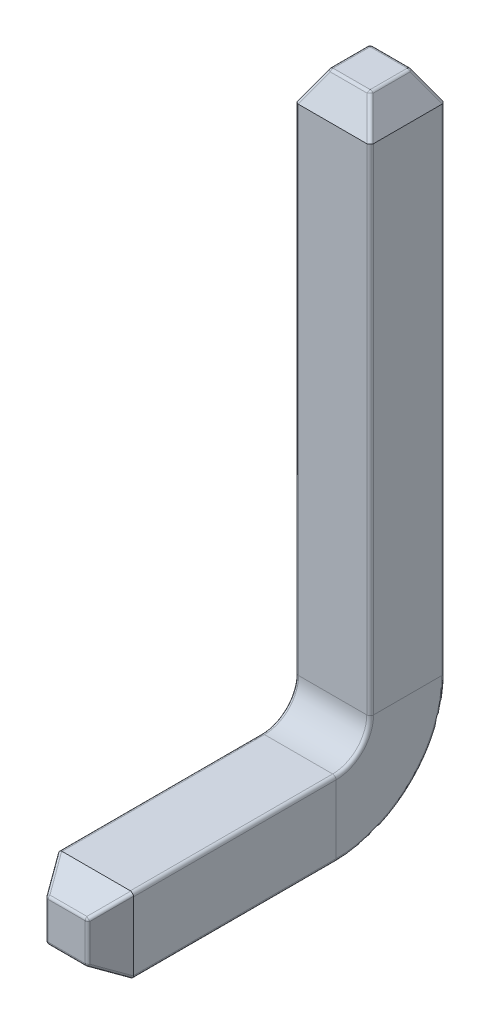
from build123d import *

# Parameters (mm, degrees)
SKETCH2_W                        = 0.44
SKETCH2_H                        = 3.715
BASE_FLANGE1_DEPTH               = 0.44
SM_EDGE_FLANGE_1_STRIP_W         = 2.16
SM_EDGE_FLANGE_1_STRIP_H         = 0.44
SM_EDGE_FLANGE_1_STRIP_CUT_DEPTH = 0.44
SM_EDGE_FLANGE_1_DEPTH           = 0.44
CHAMFER2_SIZE                    = 0.1
CHAMFER2_SIZE2                   = 0.173205081
CHAMFER3_SIZE                    = 0.1
CHAMFER3_SIZE2                   = 0.173205081
FILLET1_R                        = 0.02


# Sheet-metal steps are written as plain solids
with BuildPart() as part:
    # Base-Flange1: sheet metal written as solids
    # Sketch2 → Base-Flange1 (new body)
    with BuildSketch(Plane.XY):
        Rectangle(SKETCH2_W, SKETCH2_H)
    extrude(amount=-BASE_FLANGE1_DEPTH)

    # 边线-法兰1: sheet metal written as solids
    # 边线-法兰1 strip (on a plane across the edge) → 边线-法兰1 strip cut (cut)
    with BuildSketch(Plane(origin=(-0.22, -1.8575, 0), x_dir=(0, 1, 0), z_dir=(1, 0, 0))):
        with Locations((-0.44, -0.22)):
            Rectangle(SM_EDGE_FLANGE_1_STRIP_W, SM_EDGE_FLANGE_1_STRIP_H)
    extrude(amount=SM_EDGE_FLANGE_1_STRIP_CUT_DEPTH, mode=Mode.SUBTRACT)

    # 边线-法兰1 section (on a plane across the edge) → 边线-法兰1 (add)
    with BuildSketch(Plane(origin=(-0.22, -1.8575, 0), x_dir=(0, 1, 0), z_dir=(1, 0, 0))):
        with BuildLine():
            Line((0, 0.2), (0, 1.56))
            Line((0, 1.56), (0.44, 1.56))
            Line((0.44, 1.56), (0.44, 0.2))
            ThreePointArc((0.44, 0.2), (0.498578644, 0.058578644), (0.64, 0))
            Line((0.64, 0), (0.64, -0.44))
            ThreePointArc((0.64, -0.44), (0.18745166, -0.25254834), (0, 0.2))
        make_face()
    extrude(amount=SM_EDGE_FLANGE_1_DEPTH)

    # Chamfer2
    chamfer2_edges = [part.edges().sort_by_distance(p)[0] for p in [
        (0, 1.8575, 0),
        (-0.22, 1.8575, -0.22),
        (0.22, 1.8575, -0.22),
        (0, 1.8575, -0.44),
    ]]
    chamfer2_side = [part.faces().sort_by_distance(p)[0] for p in [
        (0, 1.8575, -0.22),
    ]]
    chamfer(chamfer2_edges, length=CHAMFER2_SIZE, length2=CHAMFER2_SIZE2, reference=chamfer2_side[0])

    # Chamfer3
    chamfer3_edges = [part.edges().sort_by_distance(p)[0] for p in [
        (-0.22, -1.6375, 1.56),
        (0, -1.8575, 1.56),
        (0, -1.4175, 1.56),
        (0.22, -1.6375, 1.56),
    ]]
    chamfer3_side = [part.faces().sort_by_distance(p)[0] for p in [
        (0, -1.6375, 1.56),
    ]]
    chamfer(chamfer3_edges, length=CHAMFER3_SIZE, length2=CHAMFER3_SIZE2, reference=chamfer3_side[0])

    # Fillet1
    # the kernel refuses this fillet: 0.02 mm, written as the material it takes off along each edge
    with BuildSketch(Plane(origin=(-0.108452995, 1.8375, -0.111547005), x_dir=(0.8320502943378433, 0.48038446141526264, -0.27735009811261363), z_dir=(-0.36927447293799925, 0.8528028654224409, 0.3692744729379992))) as fillet1_piece_1_section:
        Polygon((-0.030983867, -0.030983867), (0.030983867, -0.030983867), (0.030983867, 0.030983867), (-0.030983867, 0.030983867), align=None)
    fillet1_piece_1 = extrude(amount=0.030983867, mode=Mode.PRIVATE)
    fillet1_piece_1 = split(fillet1_piece_1, bisect_by=Plane(origin=(-0.108452995, 1.8375, -0.111547005), z_dir=(-1, 0, 0)), keep=Keep.TOP, mode=Mode.PRIVATE)
    fillet1_piece_1 = split(fillet1_piece_1, bisect_by=Plane(origin=(-0.108452995, 1.8375, -0.111547005), z_dir=(0, 0, 1)), keep=Keep.TOP, mode=Mode.PRIVATE)
    fillet1_piece_1 = split(fillet1_piece_1, bisect_by=Plane(origin=(-0.108452995, 1.8375, -0.111547005), z_dir=(0.4472135954999562, 0.7745966692414853, -0.4472135954999563)), keep=Keep.TOP, mode=Mode.PRIVATE)
    fillet1_piece_1 = split(fillet1_piece_1, bisect_by=Plane(origin=(-0.108452995, 1.8475, -0.094226497), z_dir=(0, -0.4999999999999977, -0.8660254037844399)), keep=Keep.TOP, mode=Mode.PRIVATE)
    fillet1_piece_1 = split(fillet1_piece_1, bisect_by=Plane(origin=(-0.108452995, 1.8575, -0.111547005), z_dir=(0, -1, 0)), keep=Keep.TOP, mode=Mode.PRIVATE)
    fillet1_piece_1 = split(fillet1_piece_1, bisect_by=Plane(origin=(-0.125773503, 1.8475, -0.111547005), z_dir=(0.86602540378444, -0.4999999999999976, 0)), keep=Keep.TOP, mode=Mode.PRIVATE)
    fillet1_piece_1 = fillet1_piece_1 - Plane(origin=(-0.108452995, 1.8375, -0.111547005), x_dir=(0.36927447293799925, -0.8528028654224409, -0.3692744729379992), z_dir=(0.8320502943378433, 0.48038446141526264, -0.27735009811261363)) * Sphere(FILLET1_R, mode=Mode.PRIVATE)
    add(fillet1_piece_1, mode=Mode.SUBTRACT)
    with BuildSketch(Plane(origin=(0.108452995, 1.8375, -0.111547005), x_dir=(-0.27735009811261363, 0.48038446141526264, -0.8320502943378434), z_dir=(0.36927447293799914, 0.8528028654224408, 0.36927447293799914))) as fillet1_piece_2_section:
        Polygon((-0.030983867, -0.030983867), (0.030983867, -0.030983867), (0.030983867, 0.030983867), (-0.030983867, 0.030983867), align=None)
    fillet1_piece_2 = extrude(amount=0.030983867, mode=Mode.PRIVATE)
    fillet1_piece_2 = split(fillet1_piece_2, bisect_by=Plane(origin=(0.108452995, 1.8375, -0.111547005), z_dir=(-0.4472135954999564, 0.7745966692414853, -0.4472135954999563)), keep=Keep.TOP, mode=Mode.PRIVATE)
    fillet1_piece_2 = split(fillet1_piece_2, bisect_by=Plane(origin=(0.108452995, 1.8375, -0.111547005), z_dir=(1, 0, 0)), keep=Keep.TOP, mode=Mode.PRIVATE)
    fillet1_piece_2 = split(fillet1_piece_2, bisect_by=Plane(origin=(0.108452995, 1.8375, -0.111547005), z_dir=(0, 0, 1)), keep=Keep.TOP, mode=Mode.PRIVATE)
    fillet1_piece_2 = split(fillet1_piece_2, bisect_by=Plane(origin=(0.125773503, 1.8475, -0.111547005), z_dir=(-0.8660254037844399, -0.4999999999999978, 0)), keep=Keep.TOP, mode=Mode.PRIVATE)
    fillet1_piece_2 = split(fillet1_piece_2, bisect_by=Plane(origin=(0.108452995, 1.8475, -0.094226497), z_dir=(0, -0.4999999999999977, -0.8660254037844399)), keep=Keep.TOP, mode=Mode.PRIVATE)
    fillet1_piece_2 = split(fillet1_piece_2, bisect_by=Plane(origin=(0.108452995, 1.8575, -0.111547005), z_dir=(0, -1, 0)), keep=Keep.TOP, mode=Mode.PRIVATE)
    fillet1_piece_2 = fillet1_piece_2 - Plane(origin=(0.108452995, 1.8375, -0.111547005), x_dir=(-0.36927447293799914, -0.8528028654224408, -0.36927447293799914), z_dir=(-0.27735009811261363, 0.48038446141526264, -0.8320502943378434)) * Sphere(FILLET1_R, mode=Mode.PRIVATE)
    add(fillet1_piece_2, mode=Mode.SUBTRACT)
    with BuildSketch(Plane(origin=(0.108452995, 1.8375, -0.328452995), x_dir=(0.27735009811261363, -0.48038446141526264, -0.8320502943378434), z_dir=(0.36927447293799914, 0.8528028654224408, -0.36927447293799914))) as fillet1_piece_3_section:
        Polygon((-0.030983867, -0.030983867), (0.030983867, -0.030983867), (0.030983867, 0.030983867), (-0.030983867, 0.030983867), align=None)
    fillet1_piece_3 = extrude(amount=0.030983867, mode=Mode.PRIVATE)
    fillet1_piece_3 = split(fillet1_piece_3, bisect_by=Plane(origin=(0.108452995, 1.8375, -0.328452995), z_dir=(0, 0, -1)), keep=Keep.TOP, mode=Mode.PRIVATE)
    fillet1_piece_3 = split(fillet1_piece_3, bisect_by=Plane(origin=(0.108452995, 1.8375, -0.328452995), z_dir=(1, 0, 0)), keep=Keep.TOP, mode=Mode.PRIVATE)
    fillet1_piece_3 = split(fillet1_piece_3, bisect_by=Plane(origin=(0.108452995, 1.8375, -0.328452995), z_dir=(-0.4472135954999563, 0.7745966692414852, 0.4472135954999564)), keep=Keep.TOP, mode=Mode.PRIVATE)
    fillet1_piece_3 = split(fillet1_piece_3, bisect_by=Plane(origin=(0.125773503, 1.8475, -0.328452995), z_dir=(-0.8660254037844399, -0.4999999999999978, 0)), keep=Keep.TOP, mode=Mode.PRIVATE)
    fillet1_piece_3 = split(fillet1_piece_3, bisect_by=Plane(origin=(0.108452995, 1.8575, -0.328452995), z_dir=(0, -1, 0)), keep=Keep.TOP, mode=Mode.PRIVATE)
    fillet1_piece_3 = split(fillet1_piece_3, bisect_by=Plane(origin=(0.108452995, 1.8475, -0.345773503), z_dir=(0, -0.49999999999999784, 0.8660254037844399)), keep=Keep.TOP, mode=Mode.PRIVATE)
    fillet1_piece_3 = fillet1_piece_3 - Plane(origin=(0.108452995, 1.8375, -0.328452995), x_dir=(-0.36927447293799914, -0.8528028654224408, 0.36927447293799914), z_dir=(0.27735009811261363, -0.48038446141526264, -0.8320502943378434)) * Sphere(FILLET1_R, mode=Mode.PRIVATE)
    add(fillet1_piece_3, mode=Mode.SUBTRACT)
    with BuildSketch(Plane(origin=(-0.108452995, 1.8375, -0.328452995), x_dir=(0.2773500981126135, 0.48038446141526264, 0.8320502943378434), z_dir=(-0.36927447293799925, 0.8528028654224409, -0.3692744729379992))) as fillet1_piece_4_section:
        Polygon((-0.030983867, -0.030983867), (0.030983867, -0.030983867), (0.030983867, 0.030983867), (-0.030983867, 0.030983867), align=None)
    fillet1_piece_4 = extrude(amount=0.030983867, mode=Mode.PRIVATE)
    fillet1_piece_4 = split(fillet1_piece_4, bisect_by=Plane(origin=(-0.108452995, 1.8375, -0.328452995), z_dir=(0, 0, -1)), keep=Keep.TOP, mode=Mode.PRIVATE)
    fillet1_piece_4 = split(fillet1_piece_4, bisect_by=Plane(origin=(-0.108452995, 1.8375, -0.328452995), z_dir=(-1, 0, 0)), keep=Keep.TOP, mode=Mode.PRIVATE)
    fillet1_piece_4 = split(fillet1_piece_4, bisect_by=Plane(origin=(-0.108452995, 1.8375, -0.328452995), z_dir=(0.44721359549995615, 0.7745966692414852, 0.4472135954999564)), keep=Keep.TOP, mode=Mode.PRIVATE)
    fillet1_piece_4 = split(fillet1_piece_4, bisect_by=Plane(origin=(-0.125773503, 1.8475, -0.328452995), z_dir=(0.86602540378444, -0.4999999999999976, 0)), keep=Keep.TOP, mode=Mode.PRIVATE)
    fillet1_piece_4 = split(fillet1_piece_4, bisect_by=Plane(origin=(-0.108452995, 1.8575, -0.328452995), z_dir=(0, -1, 0)), keep=Keep.TOP, mode=Mode.PRIVATE)
    fillet1_piece_4 = split(fillet1_piece_4, bisect_by=Plane(origin=(-0.108452995, 1.8475, -0.345773503), z_dir=(0, -0.49999999999999784, 0.8660254037844399)), keep=Keep.TOP, mode=Mode.PRIVATE)
    fillet1_piece_4 = fillet1_piece_4 - Plane(origin=(-0.108452995, 1.8375, -0.328452995), x_dir=(0.36927447293799925, -0.8528028654224409, 0.3692744729379992), z_dir=(0.2773500981126135, 0.48038446141526264, 0.8320502943378434)) * Sphere(FILLET1_R, mode=Mode.PRIVATE)
    add(fillet1_piece_4, mode=Mode.SUBTRACT)
    with BuildSketch(Plane(origin=(-0.108452995, -1.529047005, 1.54), x_dir=(-0.8320502943378433, 0.27735009811261585, -0.48038446141526164), z_dir=(-0.3692744729379991, 0.3692744729379959, 0.8528028654224422))) as fillet1_piece_5_section:
        Polygon((-0.030983867, -0.030983867), (0.030983867, -0.030983867), (0.030983867, 0.030983867), (-0.030983867, 0.030983867), align=None)
    fillet1_piece_5 = extrude(amount=0.030983867, mode=Mode.PRIVATE)
    fillet1_piece_5 = split(fillet1_piece_5, bisect_by=Plane(origin=(-0.108452995, -1.529047005, 1.54), z_dir=(0.44721359549995615, -0.4472135954999597, 0.7745966692414834)), keep=Keep.TOP, mode=Mode.PRIVATE)
    fillet1_piece_5 = split(fillet1_piece_5, bisect_by=Plane(origin=(-0.108452995, -1.529047005, 1.54), z_dir=(0, 1, 0)), keep=Keep.TOP, mode=Mode.PRIVATE)
    fillet1_piece_5 = split(fillet1_piece_5, bisect_by=Plane(origin=(-0.108452995, -1.529047005, 1.54), z_dir=(-1, 0, 0)), keep=Keep.TOP, mode=Mode.PRIVATE)
    fillet1_piece_5 = split(fillet1_piece_5, bisect_by=Plane(origin=(-0.108452995, -1.511726497, 1.55), z_dir=(0, -0.8660254037844378, -0.5000000000000016)), keep=Keep.TOP, mode=Mode.PRIVATE)
    fillet1_piece_5 = split(fillet1_piece_5, bisect_by=Plane(origin=(-0.125773503, -1.529047005, 1.55), z_dir=(0.8660254037844399, 1.8461148906874763e-15, -0.4999999999999977)), keep=Keep.TOP, mode=Mode.PRIVATE)
    fillet1_piece_5 = split(fillet1_piece_5, bisect_by=Plane(origin=(-0.108452995, -1.529047005, 1.56), z_dir=(0, 0, -1)), keep=Keep.TOP, mode=Mode.PRIVATE)
    fillet1_piece_5 = fillet1_piece_5 - Plane(origin=(-0.108452995, -1.529047005, 1.54), x_dir=(0.3692744729379991, -0.3692744729379959, -0.8528028654224422), z_dir=(-0.8320502943378433, 0.27735009811261585, -0.48038446141526164)) * Sphere(FILLET1_R, mode=Mode.PRIVATE)
    add(fillet1_piece_5, mode=Mode.SUBTRACT)
    with BuildSketch(Plane(origin=(0.108452995, -1.529047005, 1.54), x_dir=(0.27735009811261335, 0.8320502943378454, -0.4803844614152595), z_dir=(0.3692744729379991, 0.369274472937996, 0.8528028654224422))) as fillet1_piece_6_section:
        Polygon((-0.030983867, -0.030983867), (0.030983867, -0.030983867), (0.030983867, 0.030983867), (-0.030983867, 0.030983867), align=None)
    fillet1_piece_6 = extrude(amount=0.030983867, mode=Mode.PRIVATE)
    fillet1_piece_6 = split(fillet1_piece_6, bisect_by=Plane(origin=(0.108452995, -1.529047005, 1.54), z_dir=(-0.4472135954999561, -0.44721359549995976, 0.7745966692414834)), keep=Keep.TOP, mode=Mode.PRIVATE)
    fillet1_piece_6 = split(fillet1_piece_6, bisect_by=Plane(origin=(0.108452995, -1.529047005, 1.54), z_dir=(1, 0, 0)), keep=Keep.TOP, mode=Mode.PRIVATE)
    fillet1_piece_6 = split(fillet1_piece_6, bisect_by=Plane(origin=(0.108452995, -1.529047005, 1.54), z_dir=(0, 1, 0)), keep=Keep.TOP, mode=Mode.PRIVATE)
    fillet1_piece_6 = split(fillet1_piece_6, bisect_by=Plane(origin=(0.125773503, -1.529047005, 1.55), z_dir=(-0.8660254037844399, 1.6396415147553242e-15, -0.4999999999999977)), keep=Keep.TOP, mode=Mode.PRIVATE)
    fillet1_piece_6 = split(fillet1_piece_6, bisect_by=Plane(origin=(0.108452995, -1.511726497, 1.55), z_dir=(0, -0.8660254037844378, -0.5000000000000016)), keep=Keep.TOP, mode=Mode.PRIVATE)
    fillet1_piece_6 = split(fillet1_piece_6, bisect_by=Plane(origin=(0.108452995, -1.529047005, 1.56), z_dir=(0, 0, -1)), keep=Keep.TOP, mode=Mode.PRIVATE)
    fillet1_piece_6 = fillet1_piece_6 - Plane(origin=(0.108452995, -1.529047005, 1.54), x_dir=(-0.3692744729379991, -0.369274472937996, -0.8528028654224422), z_dir=(0.27735009811261335, 0.8320502943378454, -0.4803844614152595)) * Sphere(FILLET1_R, mode=Mode.PRIVATE)
    add(fillet1_piece_6, mode=Mode.SUBTRACT)
    with BuildSketch(Plane(origin=(-0.108452995, -1.745952995, 1.54), x_dir=(-0.2773500981126135, -0.8320502943378416, -0.4803844614152656), z_dir=(-0.3692744729379992, -0.3692744729380023, 0.8528028654224395))) as fillet1_piece_7_section:
        Polygon((-0.030983867, -0.030983867), (0.030983867, -0.030983867), (0.030983867, 0.030983867), (-0.030983867, 0.030983867), align=None)
    fillet1_piece_7 = extrude(amount=0.030983867, mode=Mode.PRIVATE)
    fillet1_piece_7 = split(fillet1_piece_7, bisect_by=Plane(origin=(-0.108452995, -1.745952995, 1.54), z_dir=(0.44721359549995626, 0.44721359549995343, 0.774596669241487)), keep=Keep.TOP, mode=Mode.PRIVATE)
    fillet1_piece_7 = split(fillet1_piece_7, bisect_by=Plane(origin=(-0.108452995, -1.745952995, 1.54), z_dir=(-1, 0, 0)), keep=Keep.TOP, mode=Mode.PRIVATE)
    fillet1_piece_7 = split(fillet1_piece_7, bisect_by=Plane(origin=(-0.108452995, -1.745952995, 1.54), z_dir=(0, -1, 0)), keep=Keep.TOP, mode=Mode.PRIVATE)
    fillet1_piece_7 = split(fillet1_piece_7, bisect_by=Plane(origin=(-0.125773503, -1.745952995, 1.55), z_dir=(0.8660254037844399, 1.8461148906874763e-15, -0.4999999999999977)), keep=Keep.TOP, mode=Mode.PRIVATE)
    fillet1_piece_7 = split(fillet1_piece_7, bisect_by=Plane(origin=(-0.108452995, -1.763273503, 1.55), z_dir=(0, 0.8660254037844418, -0.49999999999999456)), keep=Keep.TOP, mode=Mode.PRIVATE)
    fillet1_piece_7 = split(fillet1_piece_7, bisect_by=Plane(origin=(-0.108452995, -1.745952995, 1.56), z_dir=(0, 0, -1)), keep=Keep.TOP, mode=Mode.PRIVATE)
    fillet1_piece_7 = fillet1_piece_7 - Plane(origin=(-0.108452995, -1.745952995, 1.54), x_dir=(0.3692744729379992, 0.3692744729380023, -0.8528028654224395), z_dir=(-0.2773500981126135, -0.8320502943378416, -0.4803844614152656)) * Sphere(FILLET1_R, mode=Mode.PRIVATE)
    add(fillet1_piece_7, mode=Mode.SUBTRACT)
    with BuildSketch(Plane(origin=(0.108452995, -1.745952995, 1.54), x_dir=(-0.27735009811261374, 0.8320502943378416, 0.4803844614152656), z_dir=(0.3692744729379992, -0.3692744729380022, 0.8528028654224395))) as fillet1_piece_8_section:
        Polygon((-0.030983867, -0.030983867), (0.030983867, -0.030983867), (0.030983867, 0.030983867), (-0.030983867, 0.030983867), align=None)
    fillet1_piece_8 = extrude(amount=0.030983867, mode=Mode.PRIVATE)
    fillet1_piece_8 = split(fillet1_piece_8, bisect_by=Plane(origin=(0.108452995, -1.745952995, 1.54), z_dir=(-0.4472135954999564, 0.44721359549995343, 0.774596669241487)), keep=Keep.TOP, mode=Mode.PRIVATE)
    fillet1_piece_8 = split(fillet1_piece_8, bisect_by=Plane(origin=(0.108452995, -1.745952995, 1.54), z_dir=(1, 0, 0)), keep=Keep.TOP, mode=Mode.PRIVATE)
    fillet1_piece_8 = split(fillet1_piece_8, bisect_by=Plane(origin=(0.108452995, -1.745952995, 1.54), z_dir=(0, -1, 0)), keep=Keep.TOP, mode=Mode.PRIVATE)
    fillet1_piece_8 = split(fillet1_piece_8, bisect_by=Plane(origin=(0.125773503, -1.745952995, 1.55), z_dir=(-0.8660254037844399, 1.6396415147553242e-15, -0.4999999999999977)), keep=Keep.TOP, mode=Mode.PRIVATE)
    fillet1_piece_8 = split(fillet1_piece_8, bisect_by=Plane(origin=(0.108452995, -1.763273503, 1.55), z_dir=(0, 0.8660254037844418, -0.49999999999999456)), keep=Keep.TOP, mode=Mode.PRIVATE)
    fillet1_piece_8 = split(fillet1_piece_8, bisect_by=Plane(origin=(0.108452995, -1.745952995, 1.56), z_dir=(0, 0, -1)), keep=Keep.TOP, mode=Mode.PRIVATE)
    fillet1_piece_8 = fillet1_piece_8 - Plane(origin=(0.108452995, -1.745952995, 1.54), x_dir=(-0.3692744729379992, 0.3692744729380022, -0.8528028654224395), z_dir=(-0.27735009811261374, 0.8320502943378416, 0.4803844614152656)) * Sphere(FILLET1_R, mode=Mode.PRIVATE)
    add(fillet1_piece_8, mode=Mode.SUBTRACT)
    with BuildSketch(Plane(origin=(0.22, 1.734294919, 0), x_dir=(-1, 0, 0), z_dir=(0, -1, 0)), Plane(origin=(-0.22, -1.2175, -0.44), x_dir=(0, 0, 1), z_dir=(0, 1, 0))) as fillet1_piece_9:
        with BuildLine():
            CenterArc((FILLET1_R, FILLET1_R), FILLET1_R, 180, 90)
            Line((0, FILLET1_R), (0, 0))
            Line((0, 0), (FILLET1_R, 0))
        make_face()
    extrude(amount=2.951794919, mode=Mode.SUBTRACT)
    with BuildSketch(Plane(origin=(0.22, 1.734294919, -0.44), x_dir=(-1, 0, 0), z_dir=(0, -1, 0)), Plane(origin=(-0.22, -1.2175, 0), x_dir=(0, 0, -1), z_dir=(0, 1, 0))) as fillet1_piece_10:
        with BuildLine():
            CenterArc((FILLET1_R, -FILLET1_R), FILLET1_R, 90, 90)
            Line((0, -FILLET1_R), (0, 0))
            Line((0, 0), (FILLET1_R, 0))
        make_face()
    extrude(amount=2.951794919, mode=Mode.SUBTRACT)
    with BuildSketch(Plane(origin=(-0.22, -1.2175, 0.2), x_dir=(0, 0, -1), z_dir=(0, 1, 0))) as fillet1_piece_11:
        with BuildLine():
            CenterArc((0.64 - FILLET1_R, -FILLET1_R), FILLET1_R, 360, 90)
            Line((0.64, -FILLET1_R), (0.64, 0))
            Line((0.64, 0), (0.64 - FILLET1_R, 0))
        make_face()
    revolve(axis=Axis((-0.22, -1.2175, 0.2), (-1, 0, 0)), revolution_arc=90, mode=Mode.SUBTRACT)
    with BuildSketch(Plane(origin=(0.22, -1.2175, 0.2), x_dir=(0, 0, -1), z_dir=(0, 1, 0))) as fillet1_piece_12:
        with BuildLine():
            CenterArc((0.64 - FILLET1_R, FILLET1_R), FILLET1_R, 270, 90)
            Line((0.64 - FILLET1_R, 0), (0.64, 0))
            Line((0.64, 0), (0.64, FILLET1_R))
        make_face()
    revolve(axis=Axis((0.22, -1.2175, 0.2), (-1, 0, 0)), revolution_arc=90, mode=Mode.SUBTRACT)
    with BuildSketch(Plane(origin=(-0.22, -1.2175, 0.2), x_dir=(0, -1, 0), z_dir=(0, 0, 1))) as fillet1_piece_13:
        with BuildLine():
            CenterArc((0.2 + FILLET1_R, FILLET1_R), FILLET1_R, 180, 90)
            Line((0.2, FILLET1_R), (0.2, 0))
            Line((0.2, 0), (0.2 + FILLET1_R, 0))
        make_face()
    revolve(axis=Axis((-0.22, -1.2175, 0.2), (1, 0, 0)), revolution_arc=90, mode=Mode.SUBTRACT)
    with BuildSketch(Plane(origin=(0.22, -1.2175, 0.2), x_dir=(0, -1, 0), z_dir=(0, 0, 1))) as fillet1_piece_14:
        with BuildLine():
            CenterArc((0.2 + FILLET1_R, -FILLET1_R), FILLET1_R, 90, 90)
            Line((0.2 + FILLET1_R, 0), (0.2, 0))
            Line((0.2, 0), (0.2, -FILLET1_R))
        make_face()
    revolve(axis=Axis((0.22, -1.2175, 0.2), (1, 0, 0)), revolution_arc=90, mode=Mode.SUBTRACT)
    with BuildSketch(Plane(origin=(0.22, -1.4175, 1.436794919), x_dir=(-1, 0, 0), z_dir=(0, 0, -1)), Plane(origin=(0.22, -1.8575, 0.2), x_dir=(-1, 0, 0), z_dir=(0, 0, 1)), Plane(origin=(-0.22, -1.8575, 0.2), x_dir=(0, 1, 0), z_dir=(0, 0, 1)), Plane(origin=(-0.22, -1.4175, 1.436794919), x_dir=(0, -1, 0), z_dir=(0, 0, -1))) as fillet1_piece_15:
        with BuildLine():
            CenterArc((FILLET1_R, -FILLET1_R), FILLET1_R, 90, 90)
            Line((0, -FILLET1_R), (0, 0))
            Line((0, 0), (FILLET1_R, 0))
        make_face()
    extrude(amount=1.236794919, mode=Mode.SUBTRACT)
    with BuildSketch(Plane(origin=(-0.108452995, 1.8575, -0.1), x_dir=(0, -0.8660254037844376, 0.500000000000002), z_dir=(1, 0, 0)), Plane(origin=(-0.108452995, 1.8575, -0.34), x_dir=(0, 0, 1), z_dir=(1, 0, 0)), Plane(origin=(-0.108452995, -1.7575, 1.56), x_dir=(0, -0.49999999999999795, -0.8660254037844398), z_dir=(1, 0, 0))) as fillet1_piece_16:
        with BuildLine():
            CenterArc((FILLET1_R * 0.57735026919, FILLET1_R), FILLET1_R, 210, 60)
            Line((-FILLET1_R * 0.288675134595, FILLET1_R * 0.5), (0, 0))
            Line((0, 0), (FILLET1_R * 0.57735026919, 0))
        make_face()
    extrude(amount=0.216905989, mode=Mode.SUBTRACT)
    with BuildSketch(Plane(origin=(0.12, 1.8575, -0.111547005), x_dir=(-1, 0, 0), z_dir=(0, 0, -1)), Plane(origin=(-0.12, 1.8575, -0.111547005), x_dir=(-0.5000000000000002, -0.8660254037844386, 0), z_dir=(0, 0, -1)), Plane(origin=(-0.108452995, -1.5175, 1.56), x_dir=(0, 0.49999999999998357, -0.8660254037844481), z_dir=(1, 0, 0)), Plane(origin=(-0.12, -1.745952995, 1.56), x_dir=(-0.5000000000000027, 3.023711536277452e-15, -0.8660254037844372), z_dir=(0, 1, 0)), Plane(origin=(0.12, -1.745952995, 1.56), x_dir=(-1, 0, 0), z_dir=(0, 1, 0))) as fillet1_piece_17:
        with BuildLine():
            CenterArc((FILLET1_R * 0.57735026919, -FILLET1_R), FILLET1_R, 90, 60)
            Line((-FILLET1_R * 0.288675134595, -FILLET1_R * 0.5), (0, 0))
            Line((0, 0), (FILLET1_R * 0.57735026919, 0))
        make_face()
    extrude(amount=0.216905989, mode=Mode.SUBTRACT)
    with BuildSketch(Plane(origin=(0.122309401, 1.8535, -0.342309401), x_dir=(-0.8944271909999167, -0.3872983346207399, -0.22360679774997883), z_dir=(0.4472135954999563, -0.7745966692414852, -0.4472135954999564)), Plane(origin=(-0.122309401, 1.8535, -0.342309401), x_dir=(-0.22360679774998504, -0.3872983346207364, 0.8944271909999166), z_dir=(-0.4472135954999562, -0.7745966692414853, -0.44721359549995643)), Plane(origin=(-0.122309401, -1.515190599, 1.556), x_dir=(-0.22360679774997835, -0.8944271909999151, -0.3872983346207441), z_dir=(-0.44721359549995615, 0.4472135954999597, -0.7745966692414834)), Plane(origin=(0.122309401, -1.515190599, 1.556), x_dir=(-0.8944271909999167, 0.2236067977499787, -0.3872983346207397), z_dir=(0.4472135954999561, 0.44721359549995976, -0.7745966692414834))) as fillet1_piece_18:
        with BuildLine():
            CenterArc((FILLET1_R * 0.774596669241, -FILLET1_R), FILLET1_R, 90, 75.522487814)
            Line((-FILLET1_R * 0.19364916731, -FILLET1_R * 0.75), (0, 0))
            Line((0, 0), (FILLET1_R * 0.774596669241, 0))
        make_face()
    extrude(amount=0.257172653, mode=Mode.SUBTRACT)
    with BuildSketch(Plane(origin=(0.122309401, 1.8535, -0.097690599), x_dir=(-0.8944271909999166, -0.3872983346207399, 0.22360679774997883), z_dir=(0.4472135954999564, -0.7745966692414853, 0.4472135954999563)), Plane(origin=(-0.122309401, 1.8535, -0.097690599), x_dir=(-0.22360679774998238, -0.3872983346207379, -0.8944271909999167), z_dir=(-0.44721359549995626, -0.7745966692414854, 0.4472135954999564)), Plane(origin=(-0.122309401, -1.759809401, 1.556), x_dir=(-0.22360679774997672, 0.8944271909999183, -0.38729833462073776), z_dir=(-0.44721359549995626, -0.44721359549995343, -0.774596669241487)), Plane(origin=(0.122309401, -1.759809401, 1.556), x_dir=(-0.8944271909999166, -0.22360679774999576, -0.3872983346207301), z_dir=(0.4472135954999564, -0.4472135954999535, -0.774596669241487))) as fillet1_piece_19:
        with BuildLine():
            CenterArc((FILLET1_R * 0.774596669241, FILLET1_R), FILLET1_R, 194.477512186, 75.522487814)
            Line((-FILLET1_R * 0.19364916731, FILLET1_R * 0.75), (0, 0))
            Line((0, 0), (FILLET1_R * 0.774596669241, 0))
        make_face()
    extrude(amount=0.257172653, mode=Mode.SUBTRACT)


solid = part.part
